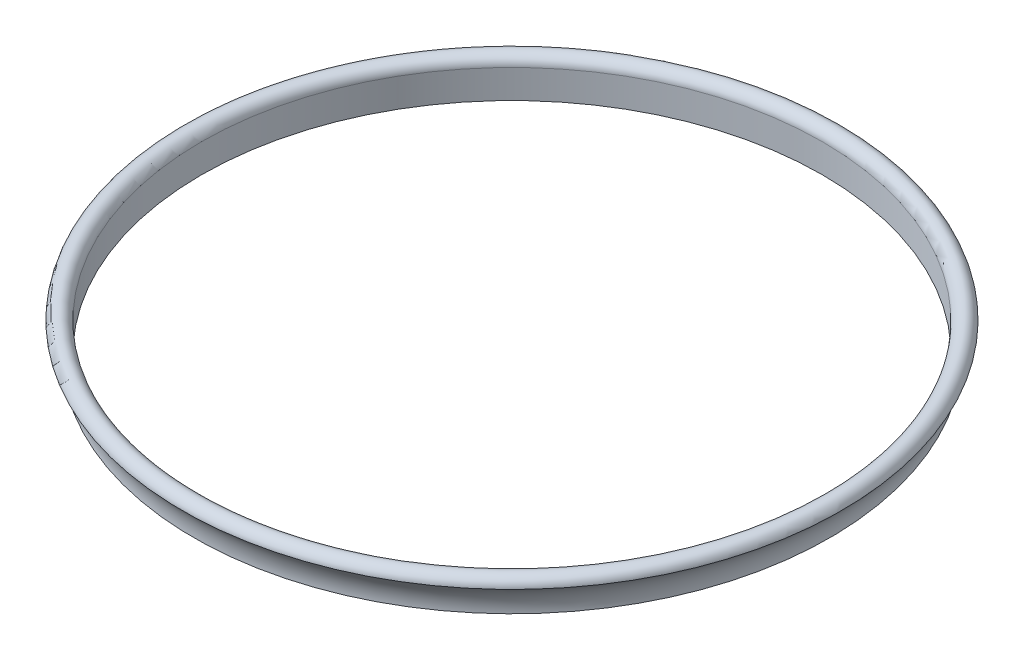
from build123d import *


with BuildPart() as part:
    # Sketch1 → Revolve1 (revolve)
    with BuildSketch(Plane.XY):
        with BuildLine():
            Line((82.55, 0), (82.55, 7.62))
            ThreePointArc((82.55, 7.62), (85.020831476, 10.159058037), (87.626232847, 7.758285746))
            ThreePointArc((87.626232847, 7.758285746), (85.257370846, 4.211392906), (84.582, 0))
            Line((84.582, 0), (82.55, 0))
        make_face()
    revolve(axis=Axis((0, 0, 0), (0, 1, 0)))


solid = part.part
